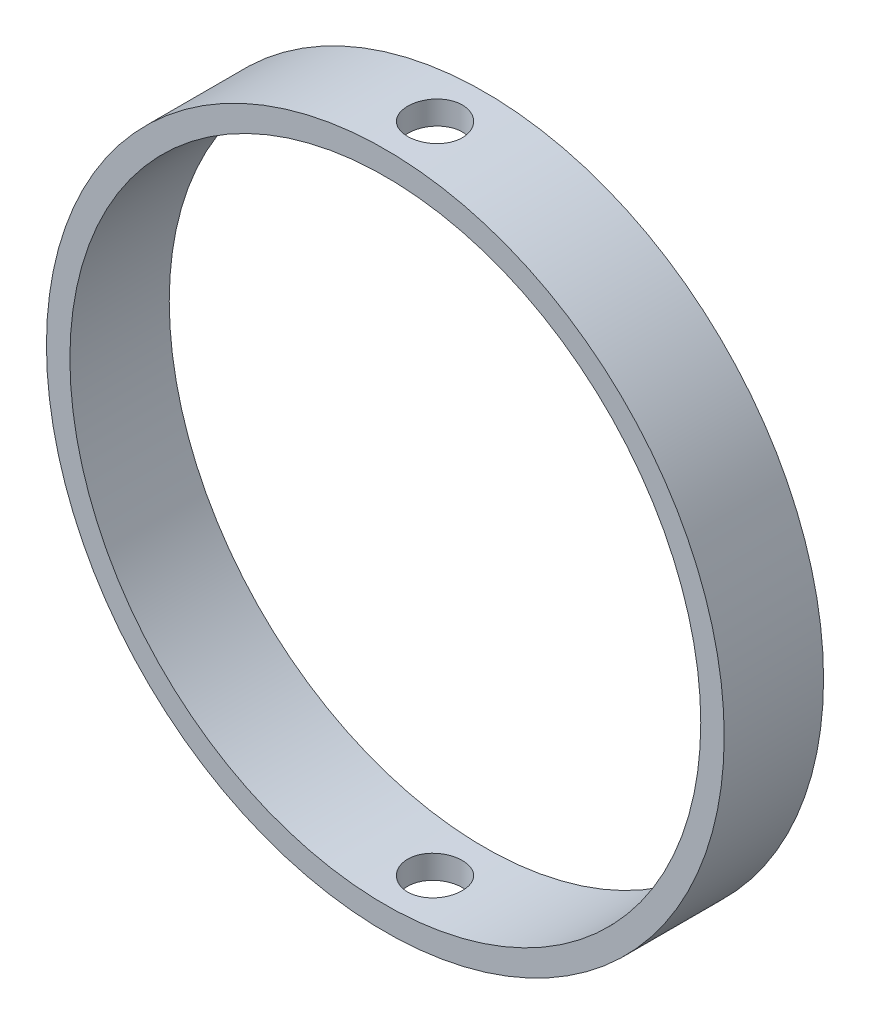
from build123d import *

# Parameters (mm, degrees)
SKETCH1_R           = 34.11
SKETCH1_R_2         = 31.75
BOSS_EXTRUDE1_DEPTH = 10
SKETCH2_R           = 2.75
CUT_EXTRUDE1_DEPTH  = 77.925031687


with BuildPart() as part:
    # Sketch1 → Boss-Extrude1 (new body)
    with BuildSketch(Plane.XY):
        Circle(SKETCH1_R)
        Circle(SKETCH1_R_2, mode=Mode.SUBTRACT)
    extrude(amount=BOSS_EXTRUDE1_DEPTH)

    # Sketch2 → Cut-Extrude1 (cut, through all)
    with BuildSketch(Plane(origin=(0, 34.11, 0), x_dir=(1, 0, 0), z_dir=(0, 1, 0))):
        with Locations((0, -5)):
            Circle(SKETCH2_R)
    extrude(amount=-CUT_EXTRUDE1_DEPTH, mode=Mode.SUBTRACT)


solid = part.part
